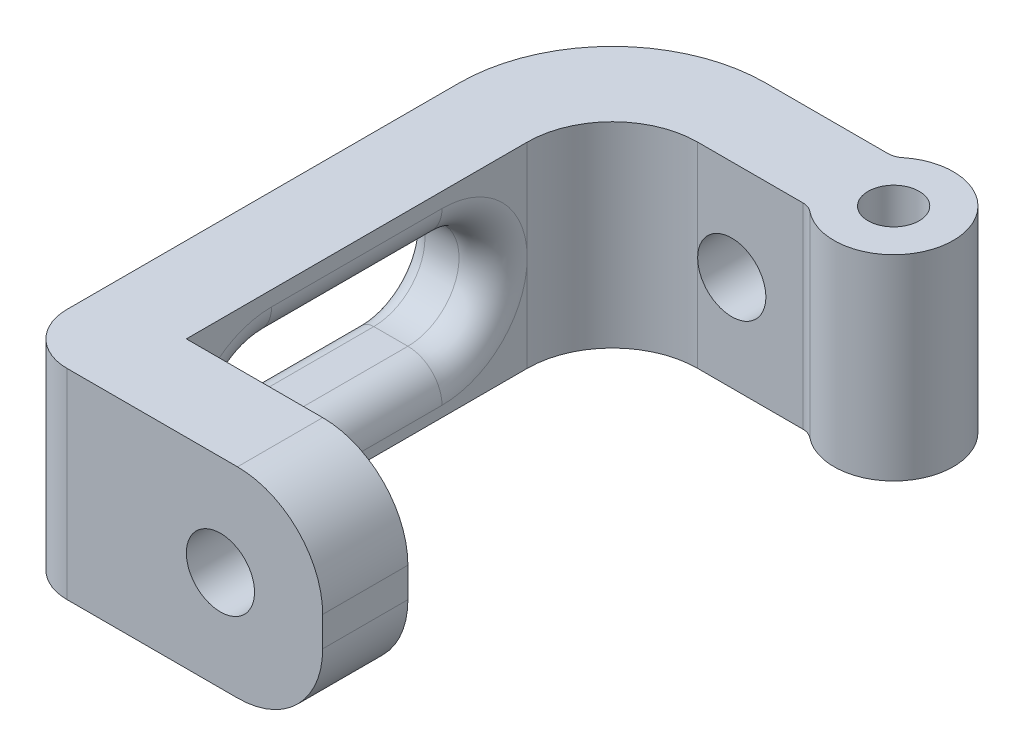
from build123d import *

# Parameters (mm, degrees)
SKETCH1_W               = 20
SKETCH1_H               = 11.5
BOSS_EXTRUDE1_DEPTH     = 5
SKETCH2_W               = 5
SKETCH2_H               = 11.5
BOSS_EXTRUDE2_DEPTH     = 25
SKETCH3_W               = 18
SKETCH3_H               = 11.75
BOSS_EXTRUDE3_DEPTH     = 5
CUT_EXTRUDE1_DEPTH      = 5
CUT_EXTRUDE2_DEPTH      = 33.186953879
CUT_EXTRUDE2_DEPTH_BACK = 33.186953879
SKETCH5_R               = 2
FILLET1_R               = 9
FILLET7_R               = 5
FILLET8_R               = 1
FILLET9_R               = 2
CUT_EXTRUDE4_DEPTH      = 39.173943993
CUT_EXTRUDE4_DEPTH_BACK = 39.173943993
SKETCH10_R              = 1.5
SKETCH10_4_R            = 3.5
SKETCH10_4_R_2          = 1.5
BOSS_EXTRUDE7_DEPTH     = 11.5
FILLET13_R              = 1
FILLET16_R              = 5
FILLET17_R              = 3


with BuildPart() as part:
    # Sketch1 → Boss-Extrude1 (new body)
    with BuildSketch(Plane.XY):
        Rectangle(SKETCH1_W, SKETCH1_H)
    extrude(amount=BOSS_EXTRUDE1_DEPTH)

    # Sketch2 → Boss-Extrude2 (add)
    with BuildSketch(Plane.XY.offset(5)):
        with Locations((-7.5, 0)):
            Rectangle(SKETCH2_W, SKETCH2_H)
    extrude(amount=BOSS_EXTRUDE2_DEPTH)

    # Sketch3 → Boss-Extrude3 (add)
    with BuildSketch(Plane.XY.offset(30)):
        with Locations((-1, -0.125)):
            Rectangle(SKETCH3_W, SKETCH3_H)
    extrude(amount=BOSS_EXTRUDE3_DEPTH)

    # Sketch4 → Cut-Extrude1 (cut)
    with BuildSketch(Plane.ZY.offset(10)):
        with BuildLine():
            Line((15, 2.875), (25, 2.875))
            ThreePointArc((25, 2.875), (28, -0.125), (25, -3.125))
            Line((25, -3.125), (15, -3.125))
            ThreePointArc((15, -3.125), (12, -0.125), (15, 2.875))
        make_face()
    extrude(amount=-CUT_EXTRUDE1_DEPTH, mode=Mode.SUBTRACT)

    # Sketch5 → Cut-Extrude2 (cut, two sides: drawn at the far end of the back side and taken through both)
    with BuildSketch(Plane(origin=(0, 0, 30), x_dir=(-1, 0, 0), z_dir=(0, 0, -1)).offset(-CUT_EXTRUDE2_DEPTH_BACK)):
        with Locations((-2, -0.125)):
            Circle(SKETCH5_R)
    extrude(amount=CUT_EXTRUDE2_DEPTH + CUT_EXTRUDE2_DEPTH_BACK, mode=Mode.SUBTRACT)

    # Fillet1
    fillet1_edges = [part.edges().sort_by_distance(p)[0] for p in [
        (-10, 0, 0),
    ]]
    fillet(fillet1_edges, radius=FILLET1_R)

    # Fillet7
    fillet7_edges = [part.edges().sort_by_distance(p)[0] for p in [
        (8, -6, 32.5),
        (8, 5.75, 32.5),
    ]]
    fillet(fillet7_edges, radius=FILLET7_R)

    # Fillet8
    fillet8_edges = [part.edges().sort_by_distance(p)[0] for p in [
        (-10, -0.125, 12),
        (-10, -3.125, 20),
        (-10, -0.125, 28),
        (-10, 2.875, 20),
    ]]
    fillet(fillet8_edges, radius=FILLET8_R)

    # Fillet9
    fillet9_edges = [part.edges().sort_by_distance(p)[0] for p in [
        (-5, -0.125, 12),
        (-5, 2.875, 20),
        (-5, -0.125, 28),
        (-5, -3.125, 20),
    ]]
    fillet(fillet9_edges, radius=FILLET9_R - 0.0001)  # a hair under: the kernel refuses the full size

    # Sketch10 → Cut-Extrude4 (cut, two sides: drawn at the far end of the back side and taken through both)
    with BuildSketch(Plane.XZ.offset(5.75).offset(-CUT_EXTRUDE4_DEPTH_BACK)):
        with Locations((9, 2.5)):
            Circle(SKETCH10_R)
    extrude(amount=CUT_EXTRUDE4_DEPTH + CUT_EXTRUDE4_DEPTH_BACK, mode=Mode.SUBTRACT)

    # Sketch10<4> → Boss-Extrude7 (add)
    with BuildSketch(Plane.XZ.offset(5.75)):
        with Locations((9, 2.5)):
            Circle(SKETCH10_4_R)
        with Locations(Location((9, 2.5, 0), (0, 0, 270))):
            Circle(SKETCH10_4_R_2, mode=Mode.SUBTRACT)
    extrude(amount=-BOSS_EXTRUDE7_DEPTH)

    # Fillet13
    fillet13_edges = [part.edges().sort_by_distance(p)[0] for p in [
        (6.550510257, 0, 0),
        (6.550510257, 0, 5),
    ]]
    fillet(fillet13_edges, radius=FILLET13_R)

    # Fillet16
    fillet16_edges = [part.edges().sort_by_distance(p)[0] for p in [
        (-5, 0, 5),
    ]]
    fillet(fillet16_edges, radius=FILLET16_R - 0.0001)  # a hair under: the kernel refuses the full size

    # Fillet17
    fillet17_edges = [part.edges().sort_by_distance(p)[0] for p in [
        (-10, -0.125, 35),
    ]]
    fillet(fillet17_edges, radius=FILLET17_R)


solid = part.part
